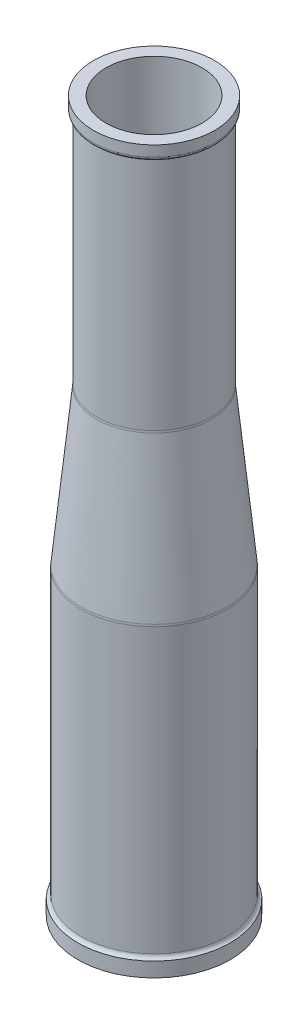
from build123d import *

# Parameters (mm, degrees)
CROQUIS1_R              = 35
SALIENTE_EXTRUIR1_DEPTH = 145
CROQUIS2_R              = 27.5
CROQUIS3_R              = 27.5
SALIENTE_EXTRUIR2_DEPTH = 120
CROQUIS5_R              = 36.5
SALIENTE_EXTRUIR3_DEPTH = 7
CROQUIS4_R              = 23
CORTAR_EXTRUIR1_DEPTH   = 525
REDONDEO1_R             = 10
SALIENTE_EXTRUIR4_START = -7
CROQUIS6_R              = 29
CROQUIS6_R_2            = 23
SALIENTE_EXTRUIR4_DEPTH = 7
REDONDEO2_R             = 2


with BuildPart() as part:
    # Croquis1 → Saliente-Extruir1 (new body)
    with BuildSketch(Plane(origin=(0, 0, 0), x_dir=(1, 0, 0), z_dir=(0, 1, 0))):
        with Locations(Location((0, 0, 0), (0, 0, 270))):
            Circle(CROQUIS1_R)
    extrude(amount=SALIENTE_EXTRUIR1_DEPTH)

    # Croquis2 → section 1 of recubrir1
    with BuildSketch(Plane(origin=(0, 220, 0), x_dir=(1, 0, 0), z_dir=(0, 1, 0)), mode=Mode.PRIVATE) as recubrir1_s1:
        Circle(CROQUIS2_R)
    # loft up to a face of the part (recubrir1)
    loft([Face(Wire([part.edges().sort_by_distance((25.51390196, 145, -23.959148708))[0]])), recubrir1_s1.sketch])

    # Croquis3 → Saliente-Extruir2 (add)
    with BuildSketch(Plane(origin=(0, 220, 0), x_dir=(1, 0, 0), z_dir=(0, 1, 0))):
        with Locations(Location((0, 0, 0), (0, 0, 270))):
            Circle(CROQUIS3_R)
    extrude(amount=SALIENTE_EXTRUIR2_DEPTH)

    # Croquis5 → Saliente-Extruir3 (add)
    with BuildSketch(Plane.XZ):
        with Locations(Location((0, 0, 0), (0, 0, 270))):
            Circle(CROQUIS5_R)
    extrude(amount=-SALIENTE_EXTRUIR3_DEPTH)

    # Croquis4 → Cortar-Extruir1 (cut)
    with BuildSketch(Plane.XZ):
        with Locations(Location((0, 0, 0), (0, 0, 270))):
            Circle(CROQUIS4_R)
    extrude(amount=-CORTAR_EXTRUIR1_DEPTH, mode=Mode.SUBTRACT)

    # Redondeo1
    # the kernel refuses this fillet: 10 mm, written as the material it adds along each edge
    with BuildSketch(Plane(origin=(0, 220, 0), x_dir=(0, 0, 1), z_dir=(1, 0, 0))) as redondeo1_piece_1:
        with BuildLine():
            CenterArc((27.5 + REDONDEO1_R, -REDONDEO1_R * 0.0498756211209), REDONDEO1_R, 174.289406863, 5.710593137)
            Line((27.5 + REDONDEO1_R * 0.00496280979001, REDONDEO1_R * 0.0496280979001), (27.5, 0))
            Line((27.5, 0), (27.5, -REDONDEO1_R * 0.0498756211209))
        make_face()
    revolve(axis=Axis((0, 220, 0), (0, -1, 0)))
    # the kernel refuses this fillet: 10 mm, written as the material it takes off along each edge
    with BuildSketch(Plane(origin=(0, 145, 0), x_dir=(0, 0, 1), z_dir=(-1, 0, 0))) as redondeo1_2_piece_1:
        with BuildLine():
            CenterArc((35 - REDONDEO1_R, -REDONDEO1_R * 0.0498756211209), REDONDEO1_R, 0, 5.710593137)
            Line((35 - REDONDEO1_R * 0.00496280979001, REDONDEO1_R * 0.0496280979001), (35, 0))
            Line((35, 0), (35, -REDONDEO1_R * 0.0498756211209))
        make_face()
    revolve(axis=Axis((0, 145, 0), (0, 1, 0)), mode=Mode.SUBTRACT)

    # Croquis6 → Saliente-Extruir4 (add)
    with BuildSketch(Plane(origin=(0, 340, 0), x_dir=(1, 0, 0), z_dir=(0, 1, 0)).offset(SALIENTE_EXTRUIR4_START)):
        with Locations(Location((0, 0, 0), (0, 0, 270))):
            Circle(CROQUIS6_R)
        with Locations(Location((0, 0, 0), (0, 0, 90))):
            Circle(CROQUIS6_R_2, mode=Mode.SUBTRACT)
    extrude(amount=SALIENTE_EXTRUIR4_DEPTH)

    # Redondeo2
    # the kernel refuses this fillet: 2 mm, written as the material it adds along each edge
    with BuildSketch(Plane(origin=(0, 7, 0), x_dir=(0, 0, 1), z_dir=(1, 0, 0))) as redondeo2_piece_1:
        with BuildLine():
            CenterArc((37, -1.936491673), REDONDEO2_R, 104.477512186, 75.522487814)
            Line((35, -1.936491673), (34.96, -1.936491673))
            Line((34.96, -1.936491673), (34.96, 0))
            Line((34.96, 0), (35, 0.04))
            ThreePointArc((35, 0.04), (35.75, 0.04), (36.49, 0.038729833))
            Line((36.49, 0.038729833), (36.5, 0))
        make_face()
    revolve(axis=Axis((0, 7, 0), (0, -1, 0)))
    # the kernel refuses this fillet: 2 mm, written as the material it takes off along each edge
    with BuildSketch(Plane(origin=(0, 333, 0), x_dir=(0, 0, 1), z_dir=(-1, 0, 0))) as redondeo2_2_piece_1:
        with BuildLine():
            CenterArc((27, 1.936491673), REDONDEO2_R, 284.477512186, 75.522487814)
            Line((29, 1.936491673), (29.04, 1.936491673))
            Line((29.04, 1.936491673), (29.04, 0))
            Line((29.04, 0), (29, -0.04))
            ThreePointArc((29, -0.04), (28.25, -0.04), (27.51, -0.038729833))
            Line((27.51, -0.038729833), (27.5, 0))
        make_face()
    revolve(axis=Axis((0, 333, 0), (0, 1, 0)), mode=Mode.SUBTRACT)


solid = part.part
